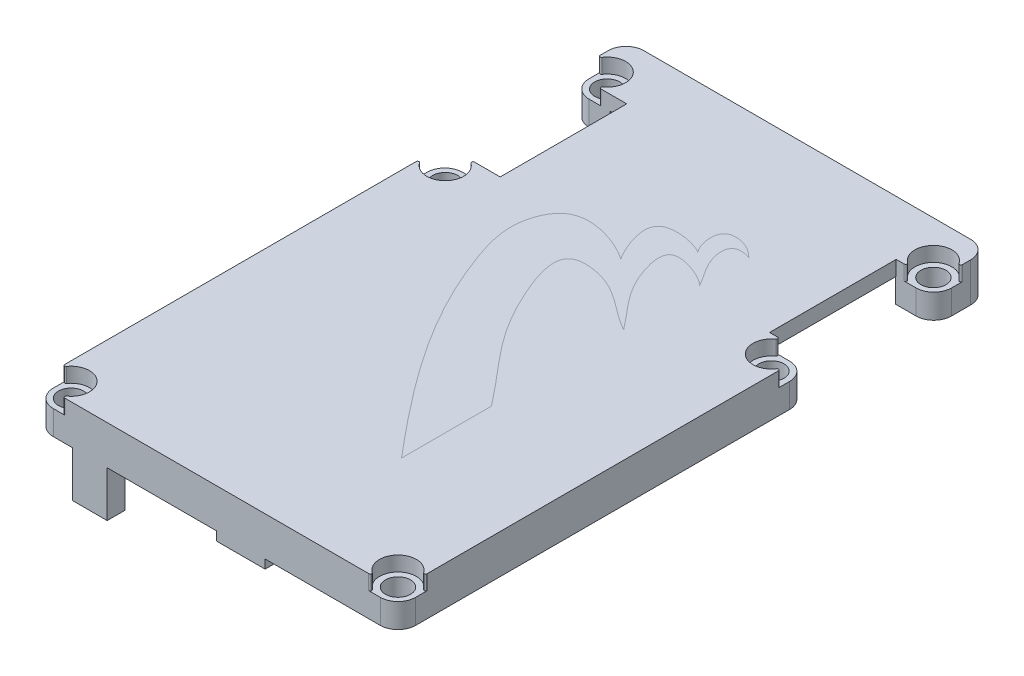
from build123d import *

# Parameters (mm, degrees)
SKETCH1_W           = 49.1
SKETCH1_H           = 80
BOSS_EXTRUDE1_DEPTH = 2
SKETCH2_R           = 1.7
CUT_EXTRUDE1_DEPTH  = 2
SKETCH3_W           = 5.2
SKETCH3_H           = 5.2
SKETCH3_R           = 1.7
BOSS_EXTRUDE2_DEPTH = 3.3
SKETCH4_W           = 7.5
SKETCH4_H           = 17.15
SKETCH4_W_2         = 5.1
CUT_EXTRUDE2_DEPTH  = 3.3
SKETCH7_W           = 38.7
SKETCH7_H           = 2.4
SKETCH7_W_2         = 2.4
SKETCH7_H_2         = 45.05
BOSS_EXTRUDE4_DEPTH = 3.3
SKETCH8_W           = 6.6
SKETCH8_H           = 1.2
SKETCH8_W_2         = 4.7
SKETCH8_H_2         = 6.2
BOSS_EXTRUDE5_DEPTH = 2.4
FILLET1_START       = -9.5
FILLET1_DEPTH       = 12.5
SKETCH9_R           = 2.5
CUT_EXTRUDE3_DEPTH  = 2
FILLET2_R           = 0.2


with BuildPart() as part:
    # Sketch1 → Boss-Extrude1 (new body)
    with BuildSketch(Plane(origin=(0, 0, 0), x_dir=(1, 0, 0), z_dir=(0, 1, 0))):
        with Locations((24.55, -40)):
            Rectangle(SKETCH1_W, SKETCH1_H)
    extrude(amount=BOSS_EXTRUDE1_DEPTH)

    # Sketch2 → Cut-Extrude1 (cut)
    with BuildSketch(Plane(origin=(0, 2, 0), x_dir=(1, 0, 0), z_dir=(0, 1, 0))):
        with Locations(Location((2.4, -77.6, 0), (0, 0, 270))):
            Circle(SKETCH2_R)
        with Locations(Location((2.45, -26.95, 0), (0, 0, 270))):
            Circle(SKETCH2_R)
        with Locations(Location((2.45, -5, 0), (0, 0, 270))):
            Circle(SKETCH2_R)
        with Locations(Location((46.7, -77.6, 0), (0, 0, 90))):
            Circle(SKETCH2_R)
        with Locations(Location((46.65, -26.95, 0), (0, 0, 90))):
            Circle(SKETCH2_R)
        with Locations(Location((46.65, -5, 0), (0, 0, 90))):
            Circle(SKETCH2_R)
    extrude(amount=-CUT_EXTRUDE1_DEPTH, mode=Mode.SUBTRACT)

    # Sketch3 → Boss-Extrude2 (add)
    # profile 1 of 6: a face of its own
    with BuildSketch(Plane.XZ):
        with Locations((2.6, 77.4)):
            Rectangle(SKETCH3_W, SKETCH3_H)
        with Locations(Location((2.4, 77.6, 0), (0, 0, 90))):
            Circle(SKETCH3_R, mode=Mode.SUBTRACT)
    # profile 2 of 6: a face of its own
    with BuildSketch(Plane.XZ):
        with Locations((2.6, 27.15)):
            Rectangle(SKETCH3_W, SKETCH3_H)
        with Locations(Location((2.45, 26.95, 0), (0, 0, 90))):
            Circle(SKETCH3_R, mode=Mode.SUBTRACT)
    # profile 3 of 6: a face of its own
    with BuildSketch(Plane.XZ):
        with Locations((2.6, 4.8)):
            Rectangle(SKETCH3_W, SKETCH3_H)
        with Locations(Location((2.45, 5, 0), (0, 0, 90))):
            Circle(SKETCH3_R, mode=Mode.SUBTRACT)
    # profile 4 of 6: a face of its own
    with BuildSketch(Plane.XZ):
        with Locations((46.5, 4.8)):
            Rectangle(SKETCH3_W, SKETCH3_H)
        with Locations(Location((46.65, 5, 0), (0, 0, 270))):
            Circle(SKETCH3_R, mode=Mode.SUBTRACT)
    # profile 5 of 6: a face of its own
    with BuildSketch(Plane.XZ):
        with Locations((46.5, 27.15)):
            Rectangle(SKETCH3_W, SKETCH3_H)
        with Locations(Location((46.65, 26.95, 0), (0, 0, 90))):
            Circle(SKETCH3_R, mode=Mode.SUBTRACT)
    # profile 6 of 6: a face of its own
    with BuildSketch(Plane.XZ):
        with Locations((46.5, 77.4)):
            Rectangle(SKETCH3_W, SKETCH3_H)
        with Locations(Location((46.7, 77.6, 0), (0, 0, 90))):
            Circle(SKETCH3_R, mode=Mode.SUBTRACT)
    extrude(amount=BOSS_EXTRUDE2_DEPTH)

    # Sketch4 → Cut-Extrude2 (cut)
    with BuildSketch(Plane(origin=(0, 2, 0), x_dir=(1, 0, 0), z_dir=(0, 1, 0))):
        with Locations((3.75, -15.975)):
            Rectangle(SKETCH4_W, SKETCH4_H)
        with Locations((46.55, -15.975)):
            Rectangle(SKETCH4_W_2, SKETCH4_H)
    extrude(amount=-CUT_EXTRUDE2_DEPTH, mode=Mode.SUBTRACT)

    # Sketch7 → Boss-Extrude4 (add)
    with BuildSketch(Plane.XZ):
        with Locations((24.55, 78.8)):
            Rectangle(SKETCH7_W, SKETCH7_H)
        with Locations((47.9, 52.275)):
            Rectangle(SKETCH7_W_2, SKETCH7_H_2)
        with Locations((1.2, 52.275)):
            Rectangle(SKETCH7_W_2, SKETCH7_H_2)
        Polygon((0, 0), (49.1, 0), (49.1, 2), (49.1, 2.2), (43.9, 2.2), (43.9, 2), (5.2, 2), (5.2, 2.2), (0, 2.2), (0, 2), align=None)
    extrude(amount=BOSS_EXTRUDE4_DEPTH)

    # Sketch8 → Boss-Extrude5 (add)
    with BuildSketch(Plane.XY.offset(80)):
        with Locations((27.8, -3.9)):
            Rectangle(SKETCH8_W, SKETCH8_H)
        with Locations((7.35, -6.4)):
            Rectangle(SKETCH8_W_2, SKETCH8_H_2)
    extrude(amount=-BOSS_EXTRUDE5_DEPTH)

    # Fillet1: read off the stored shape, not the designer's step
    # Fillet1 outline → Fillet1 (cut)
    with BuildSketch(Plane(origin=(0, 0, 0), x_dir=(1, 0, 0), z_dir=(0, 1, 0)).offset(FILLET1_START)):
        with BuildLine():
            Line((0, 0), (0, -2.4))
            ThreePointArc((0, -2.4), (0.702943725, -0.702943725), (2.4, 0))
            Line((2.4, 0), (0, 0))
        make_face()
        with BuildLine():
            ThreePointArc((2.4, -7.4), (0.702943725, -6.697056275), (0, -5))
            Line((0, -5), (0, -7.4))
            Line((0, -7.4), (2.4, -7.4))
        make_face()
        with BuildLine():
            Line((49.1, -7.4), (49.1, -5))
            ThreePointArc((49.1, -5), (48.397056275, -6.697056275), (46.7, -7.4))
            Line((46.7, -7.4), (49.1, -7.4))
        make_face()
        with BuildLine():
            Line((49.1, 0), (46.7, 0))
            ThreePointArc((46.7, 0), (48.397056275, -0.702943725), (49.1, -2.4))
            Line((49.1, -2.4), (49.1, 0))
        make_face()
        with BuildLine():
            Line((0, -80), (2.4, -80))
            ThreePointArc((2.4, -80), (0.702943725, -79.297056275), (0, -77.6))
            Line((0, -77.6), (0, -80))
        make_face()
        with BuildLine():
            ThreePointArc((46.7, -24.55), (48.397056275, -25.252943725), (49.1, -26.95))
            Line((49.1, -26.95), (49.1, -24.55))
            Line((49.1, -24.55), (46.7, -24.55))
        make_face()
        with BuildLine():
            ThreePointArc((49.1, -77.6), (48.397056275, -79.297056275), (46.7, -80))
            Line((46.7, -80), (49.1, -80))
            Line((49.1, -80), (49.1, -77.6))
        make_face()
        with BuildLine():
            Line((0, -24.55), (0, -26.95))
            ThreePointArc((0, -26.95), (0.702943725, -25.252943725), (2.4, -24.55))
            Line((2.4, -24.55), (0, -24.55))
        make_face()
    extrude(amount=FILLET1_DEPTH, mode=Mode.SUBTRACT)

    # Sketch9 → Cut-Extrude3 (cut)
    with BuildSketch(Plane(origin=(0, 2, 0), x_dir=(1, 0, 0), z_dir=(0, 1, 0))):
        with Locations((2.45, -5)):
            Circle(SKETCH9_R)
        with Locations((2.45, -26.95)):
            Circle(SKETCH9_R)
        with Locations((2.4, -77.6)):
            Circle(SKETCH9_R)
        with Locations((46.7, -77.6)):
            Circle(SKETCH9_R)
        with Locations((46.65, -26.95)):
            Circle(SKETCH9_R)
        with Locations((46.65, -5)):
            Circle(SKETCH9_R)
    extrude(amount=-CUT_EXTRUDE3_DEPTH, mode=Mode.SUBTRACT)

    # Fillet2
    fillet2_edges = [part.edges().sort_by_distance(p)[0] for p in [
        (45.95, 1, 24.55),
        (45.95, 1, 7.4),
        (3.15, 1, 7.4),
        (3.15, 1, 24.55),
        (49.1, 1, 4.502506281),
        (49.1, 1, 27.447493719),
        (49.1, 1, 76.9),
        (46, 1, 80),
        (0, 1, 76.9),
        (3.1, 1, 80),
        (0, 1, 27.447493719),
        (0, 1, 4.502506281),
    ]]
    fillet(fillet2_edges, radius=FILLET2_R)


solid = part.part
